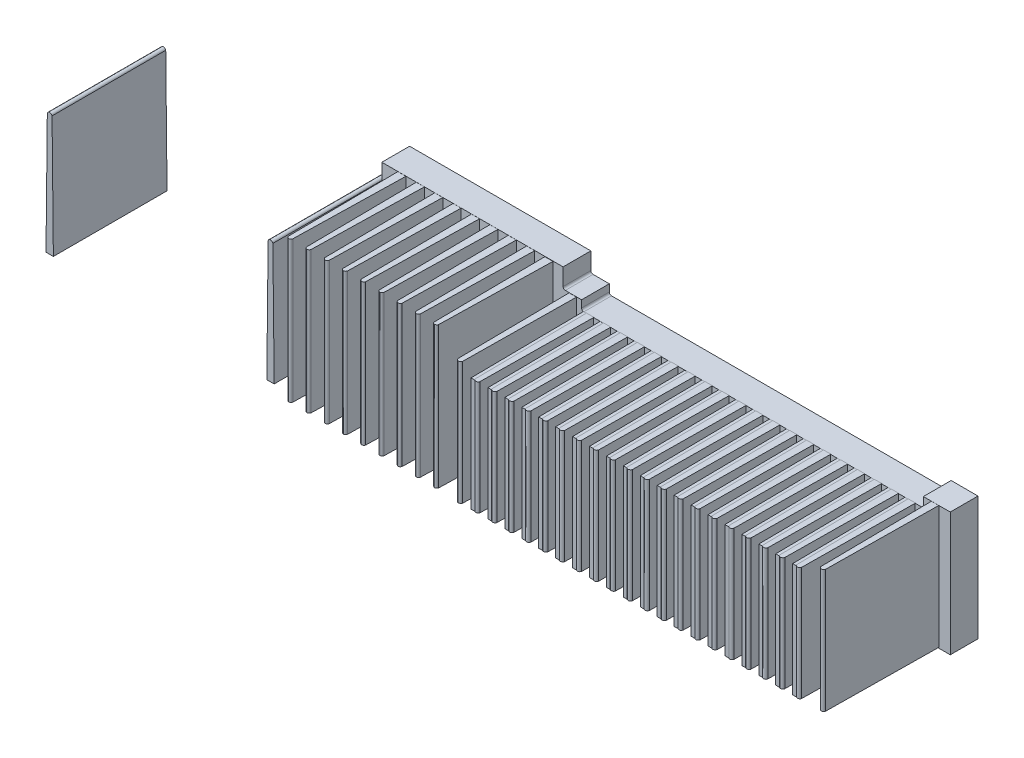
from build123d import *

# Parameters (mm, degrees)
BOSS_EXTRUDE1_DEPTH    = 9.5758
BOSS_EXTRUDE2_DEPTH    = 39.2303
BOSS_EXTRUDE2_2_DEPTH  = 39.2303
BOSS_EXTRUDE2_3_DEPTH  = 39.2303
BOSS_EXTRUDE2_4_DEPTH  = 39.2303
BOSS_EXTRUDE2_5_DEPTH  = 39.2303
BOSS_EXTRUDE2_6_DEPTH  = 39.2303
BOSS_EXTRUDE2_7_DEPTH  = 39.2303
BOSS_EXTRUDE2_8_DEPTH  = 39.2303
BOSS_EXTRUDE2_9_DEPTH  = 39.2303
BOSS_EXTRUDE2_10_DEPTH = 39.2303
BOSS_EXTRUDE2_11_DEPTH = 39.2303
BOSS_EXTRUDE2_12_DEPTH = 39.2303
BOSS_EXTRUDE2_13_DEPTH = 39.2303
BOSS_EXTRUDE2_14_DEPTH = 39.2303
BOSS_EXTRUDE2_15_DEPTH = 39.2303
BOSS_EXTRUDE2_16_DEPTH = 39.2303
BOSS_EXTRUDE2_17_DEPTH = 39.2303
BOSS_EXTRUDE2_18_DEPTH = 39.2303
BOSS_EXTRUDE2_19_DEPTH = 39.2303
BOSS_EXTRUDE2_20_DEPTH = 39.2303
BODY_MOVE_COPY1_ANGLE  = 90
BOSS_EXTRUDE3_DEPTH    = 48.8315
BOSS_EXTRUDE3_2_DEPTH  = 48.8315
BOSS_EXTRUDE3_3_DEPTH  = 48.8315
BOSS_EXTRUDE3_4_DEPTH  = 48.8315
BOSS_EXTRUDE3_5_DEPTH  = 48.8315
BOSS_EXTRUDE3_6_DEPTH  = 48.8315
BOSS_EXTRUDE3_7_DEPTH  = 48.8315
BOSS_EXTRUDE3_8_DEPTH  = 48.8315
BOSS_EXTRUDE3_9_DEPTH  = 48.8315
BODY_MOVE_COPY4_ANGLE  = 90.001090824
SKETCH40_W             = 9.271
SKETCH40_H             = 6.466041836
CUT_EXTRUDE1_DEPTH     = 213.052248313
FILLET2_R              = 0.762
FILLET3_R              = 0.762
FILLET4_R              = 0.762
BOSS_EXTRUDE4_DEPTH    = 39.2303
BOSS_EXTRUDE4_2_DEPTH  = 39.2303
BOSS_EXTRUDE4_3_DEPTH  = 39.2303
BOSS_EXTRUDE4_4_DEPTH  = 39.2303
BOSS_EXTRUDE4_5_DEPTH  = 39.2303
BOSS_EXTRUDE4_6_DEPTH  = 39.2303
BOSS_EXTRUDE4_7_DEPTH  = 39.2303
BOSS_EXTRUDE4_8_DEPTH  = 39.2303
BOSS_EXTRUDE4_9_DEPTH  = 39.2303
BOSS_EXTRUDE4_10_DEPTH = 39.2303
BOSS_EXTRUDE4_11_DEPTH = 39.2303
BOSS_EXTRUDE4_12_DEPTH = 39.2303
BOSS_EXTRUDE4_13_DEPTH = 39.2303
BOSS_EXTRUDE4_14_DEPTH = 39.2303
BOSS_EXTRUDE4_15_DEPTH = 39.2303
BOSS_EXTRUDE4_16_DEPTH = 39.2303
BOSS_EXTRUDE4_17_DEPTH = 39.2303
BOSS_EXTRUDE4_18_DEPTH = 39.2303
BOSS_EXTRUDE4_19_DEPTH = 39.2303
BOSS_EXTRUDE4_20_DEPTH = 39.2303
BODY_MOVE_COPY6_ANGLE  = 90
BOSS_EXTRUDE5_DEPTH    = 39.2303
BOSS_EXTRUDE5_2_DEPTH  = 39.2303
BOSS_EXTRUDE6_DEPTH    = 42.418
BOSS_EXTRUDE6_2_DEPTH  = 42.418
BODY_MOVE_COPY8_ANGLE  = 90


with BuildPart() as part:
    # Sketch1 → Boss-Extrude1 (new body)
    with BuildSketch(Plane.XY):
        Polygon((193.2305, 49.145371092), (193.2305, 39.267041383), (75.26958247, 39.267041383), (75.26958247, 42.495421295), (68.8975, 42.495421295), (68.8975, 49.145371092), (6.35, 49.145371092), (6.35, 42.495421295), (6.35, 0), (202.5015, 0), (202.5015, 49.145371092), align=None)
    extrude(amount=BOSS_EXTRUDE1_DEPTH)

    # Sketch40 → Cut-Extrude1 (cut, through all)
    with BuildSketch(Plane.XY.offset(9.5758)):
        with Locations((197.866, 45.912350174)):
            Rectangle(SKETCH40_W, SKETCH40_H)
    extrude(amount=-CUT_EXTRUDE1_DEPTH, mode=Mode.SUBTRACT)

    # Fillet2
    fillet2_edges = [part.edges().sort_by_distance(p)[0] for p in [
        (68.8975, 42.495421295, 4.7879),
    ]]
    fillet(fillet2_edges, radius=FILLET2_R)

    # Fillet3
    fillet3_edges = [part.edges().sort_by_distance(p)[0] for p in [
        (75.26958247, 39.267041383, 4.7879),
    ]]
    fillet(fillet3_edges, radius=FILLET3_R)

    # Fillet4
    fillet4_edges = [part.edges().sort_by_distance(p)[0] for p in [
        (193.2305, 39.267041383, 4.7879),
    ]]
    fillet(fillet4_edges, radius=FILLET4_R)


with BuildPart() as body_2:
    # Sketch 2 → Boss-Extrude2 (new body)
    with BuildSketch(Plane(origin=(57.15, 0, 0), x_dir=(1, 0, 0), z_dir=(0, 0, 1))):
        Polygon((132.141789869, 39.038500184), (134.001430641, 39.038500184), (134.439580641, -0.191799816), (132.903789869, -0.191799816), (131.703639869, -0.191799816), align=None)
    extrude(amount=BOSS_EXTRUDE2_DEPTH)


with BuildPart() as body_3:
    # Sketch 2 → Boss-Extrude2 2 (new body)
    with BuildSketch(Plane(origin=(57.15, 0, 0), x_dir=(1, 0, 0), z_dir=(0, 0, 1))):
        Polygon((127.061789869, -0.191799816), (125.861639869, -0.191799816), (126.299789869, 39.038500184), (128.159430641, 39.038500184), (128.597580641, -0.191799816), align=None)
    extrude(amount=BOSS_EXTRUDE2_2_DEPTH)


with BuildPart() as body_4:
    # Sketch 2 → Boss-Extrude2 3 (new body)
    with BuildSketch(Plane(origin=(57.15, 0, 0), x_dir=(1, 0, 0), z_dir=(0, 0, 1))):
        Polygon((121.219789869, -0.191799816), (120.019639869, -0.191799816), (120.457789869, 39.038500184), (122.317430641, 39.038500184), (122.755580641, -0.191799816), align=None)
    extrude(amount=BOSS_EXTRUDE2_3_DEPTH)


with BuildPart() as body_5:
    # Sketch 2 → Boss-Extrude2 4 (new body)
    with BuildSketch(Plane(origin=(57.15, 0, 0), x_dir=(1, 0, 0), z_dir=(0, 0, 1))):
        Polygon((115.377789869, -0.191799816), (114.177639869, -0.191799816), (114.615789869, 39.038500184), (116.475430641, 39.038500184), (116.913580641, -0.191799816), align=None)
    extrude(amount=BOSS_EXTRUDE2_4_DEPTH)


with BuildPart() as body_6:
    # Sketch 2 → Boss-Extrude2 5 (new body)
    with BuildSketch(Plane(origin=(57.15, 0, 0), x_dir=(1, 0, 0), z_dir=(0, 0, 1))):
        Polygon((109.535789869, -0.191799816), (108.335639869, -0.191799816), (108.773789869, 39.038500184), (110.633430641, 39.038500184), (111.071580641, -0.191799816), align=None)
    extrude(amount=BOSS_EXTRUDE2_5_DEPTH)


with BuildPart() as body_7:
    # Sketch 2 → Boss-Extrude2 6 (new body)
    with BuildSketch(Plane(origin=(57.15, 0, 0), x_dir=(1, 0, 0), z_dir=(0, 0, 1))):
        Polygon((103.693789869, -0.191799816), (102.493639869, -0.191799816), (102.931789869, 39.038500184), (104.791430641, 39.038500184), (105.229580641, -0.191799816), align=None)
    extrude(amount=BOSS_EXTRUDE2_6_DEPTH)


with BuildPart() as body_8:
    # Sketch 2 → Boss-Extrude2 7 (new body)
    with BuildSketch(Plane(origin=(57.15, 0, 0), x_dir=(1, 0, 0), z_dir=(0, 0, 1))):
        Polygon((97.851789869, -0.191799816), (96.651639869, -0.191799816), (97.089789869, 39.038500184), (98.949430641, 39.038500184), (99.387580641, -0.191799816), align=None)
    extrude(amount=BOSS_EXTRUDE2_7_DEPTH)


with BuildPart() as body_9:
    # Sketch 2 → Boss-Extrude2 8 (new body)
    with BuildSketch(Plane(origin=(57.15, 0, 0), x_dir=(1, 0, 0), z_dir=(0, 0, 1))):
        Polygon((92.009789869, -0.191799816), (90.809639869, -0.191799816), (91.247789869, 39.038500184), (93.107430641, 39.038500184), (93.545580641, -0.191799816), align=None)
    extrude(amount=BOSS_EXTRUDE2_8_DEPTH)


with BuildPart() as body_10:
    # Sketch 2 → Boss-Extrude2 9 (new body)
    with BuildSketch(Plane(origin=(57.15, 0, 0), x_dir=(1, 0, 0), z_dir=(0, 0, 1))):
        Polygon((86.167789869, -0.191799816), (84.967639869, -0.191799816), (85.405789869, 39.038500184), (87.265430641, 39.038500184), (87.703580641, -0.191799816), align=None)
    extrude(amount=BOSS_EXTRUDE2_9_DEPTH)


with BuildPart() as body_11:
    # Sketch 2 → Boss-Extrude2 10 (new body)
    with BuildSketch(Plane(origin=(57.15, 0, 0), x_dir=(1, 0, 0), z_dir=(0, 0, 1))):
        Polygon((80.325789869, -0.191799816), (79.125639869, -0.191799816), (79.563789869, 39.038500184), (81.423430641, 39.038500184), (81.861580641, -0.191799816), align=None)
    extrude(amount=BOSS_EXTRUDE2_10_DEPTH)


with BuildPart() as body_12:
    # Sketch 2 → Boss-Extrude2 11 (new body)
    with BuildSketch(Plane(origin=(57.15, 0, 0), x_dir=(1, 0, 0), z_dir=(0, 0, 1))):
        Polygon((74.483789869, -0.191799816), (73.283639869, -0.191799816), (73.721789869, 39.038500184), (75.581430641, 39.038500184), (76.019580641, -0.191799816), align=None)
    extrude(amount=BOSS_EXTRUDE2_11_DEPTH)


with BuildPart() as body_13:
    # Sketch 2 → Boss-Extrude2 12 (new body)
    with BuildSketch(Plane(origin=(57.15, 0, 0), x_dir=(1, 0, 0), z_dir=(0, 0, 1))):
        Polygon((68.641789869, -0.191799816), (67.441639869, -0.191799816), (67.879789869, 39.038500184), (69.739430641, 39.038500184), (70.177580641, -0.191799816), align=None)
    extrude(amount=BOSS_EXTRUDE2_12_DEPTH)


with BuildPart() as body_14:
    # Sketch 2 → Boss-Extrude2 13 (new body)
    with BuildSketch(Plane(origin=(57.15, 0, 0), x_dir=(1, 0, 0), z_dir=(0, 0, 1))):
        Polygon((62.799789869, -0.191799816), (61.599639869, -0.191799816), (62.037789869, 39.038500184), (63.897430641, 39.038500184), (64.335580641, -0.191799816), align=None)
    extrude(amount=BOSS_EXTRUDE2_13_DEPTH)


with BuildPart() as body_15:
    # Sketch 2 → Boss-Extrude2 14 (new body)
    with BuildSketch(Plane(origin=(57.15, 0, 0), x_dir=(1, 0, 0), z_dir=(0, 0, 1))):
        Polygon((56.957789869, -0.191799816), (55.757639869, -0.191799816), (56.195789869, 39.038500184), (58.055430641, 39.038500184), (58.493580641, -0.191799816), align=None)
    extrude(amount=BOSS_EXTRUDE2_14_DEPTH)


with BuildPart() as body_16:
    # Sketch 2 → Boss-Extrude2 15 (new body)
    with BuildSketch(Plane(origin=(57.15, 0, 0), x_dir=(1, 0, 0), z_dir=(0, 0, 1))):
        Polygon((51.115789869, -0.191799816), (49.915639869, -0.191799816), (50.353789869, 39.038500184), (52.213430641, 39.038500184), (52.651580641, -0.191799816), align=None)
    extrude(amount=BOSS_EXTRUDE2_15_DEPTH)


with BuildPart() as body_17:
    # Sketch 2 → Boss-Extrude2 16 (new body)
    with BuildSketch(Plane(origin=(57.15, 0, 0), x_dir=(1, 0, 0), z_dir=(0, 0, 1))):
        Polygon((45.273789869, -0.191799816), (44.073639869, -0.191799816), (44.511789869, 39.038500184), (46.371430641, 39.038500184), (46.809580641, -0.191799816), align=None)
    extrude(amount=BOSS_EXTRUDE2_16_DEPTH)


with BuildPart() as body_18:
    # Sketch 2 → Boss-Extrude2 17 (new body)
    with BuildSketch(Plane(origin=(57.15, 0, 0), x_dir=(1, 0, 0), z_dir=(0, 0, 1))):
        Polygon((39.431789869, -0.191799816), (38.231639869, -0.191799816), (38.669789869, 39.038500184), (40.529430641, 39.038500184), (40.967580641, -0.191799816), align=None)
    extrude(amount=BOSS_EXTRUDE2_17_DEPTH)


with BuildPart() as body_19:
    # Sketch 2 → Boss-Extrude2 18 (new body)
    with BuildSketch(Plane(origin=(57.15, 0, 0), x_dir=(1, 0, 0), z_dir=(0, 0, 1))):
        Polygon((33.589789869, -0.191799816), (32.389639869, -0.191799816), (32.827789869, 39.038500184), (34.687430641, 39.038500184), (35.125580641, -0.191799816), align=None)
    extrude(amount=BOSS_EXTRUDE2_18_DEPTH)


with BuildPart() as body_20:
    # Sketch 2 → Boss-Extrude2 19 (new body)
    with BuildSketch(Plane(origin=(57.15, 0, 0), x_dir=(1, 0, 0), z_dir=(0, 0, 1))):
        Polygon((27.747789869, -0.191799816), (26.547639869, -0.191799816), (26.985789869, 39.038500184), (28.845430641, 39.038500184), (29.283580641, -0.191799816), align=None)
    extrude(amount=BOSS_EXTRUDE2_19_DEPTH)


with BuildPart() as body_21:
    # Sketch 2 → Boss-Extrude2 20 (new body)
    with BuildSketch(Plane(origin=(57.15, 0, 0), x_dir=(1, 0, 0), z_dir=(0, 0, 1))):
        Polygon((21.905789869, -0.191799816), (20.705639869, -0.191799816), (21.143789869, 39.038500184), (23.003430641, 39.038500184), (23.441580641, -0.191799816), align=None)
    extrude(amount=BOSS_EXTRUDE2_20_DEPTH)


with BuildPart() as body_2_1:
    # Body-Move/Copy1: moved
    add(body_2.part.rotate(Axis((0, 19.423350184, 19.61515), (1, 0, 0)), BODY_MOVE_COPY1_ANGLE))


with BuildPart() as body_3_1:
    # Body-Move/Copy1: moved
    add(body_3.part.rotate(Axis((0, 19.423350184, 19.61515), (1, 0, 0)), BODY_MOVE_COPY1_ANGLE))


with BuildPart() as body_4_1:
    # Body-Move/Copy1: moved
    add(body_4.part.rotate(Axis((0, 19.423350184, 19.61515), (1, 0, 0)), BODY_MOVE_COPY1_ANGLE))


with BuildPart() as body_5_1:
    # Body-Move/Copy1: moved
    add(body_5.part.rotate(Axis((0, 19.423350184, 19.61515), (1, 0, 0)), BODY_MOVE_COPY1_ANGLE))


with BuildPart() as body_6_1:
    # Body-Move/Copy1: moved
    add(body_6.part.rotate(Axis((0, 19.423350184, 19.61515), (1, 0, 0)), BODY_MOVE_COPY1_ANGLE))


with BuildPart() as body_7_1:
    # Body-Move/Copy1: moved
    add(body_7.part.rotate(Axis((0, 19.423350184, 19.61515), (1, 0, 0)), BODY_MOVE_COPY1_ANGLE))


with BuildPart() as body_8_1:
    # Body-Move/Copy1: moved
    add(body_8.part.rotate(Axis((0, 19.423350184, 19.61515), (1, 0, 0)), BODY_MOVE_COPY1_ANGLE))


with BuildPart() as body_9_1:
    # Body-Move/Copy1: moved
    add(body_9.part.rotate(Axis((0, 19.423350184, 19.61515), (1, 0, 0)), BODY_MOVE_COPY1_ANGLE))


with BuildPart() as body_10_1:
    # Body-Move/Copy1: moved
    add(body_10.part.rotate(Axis((0, 19.423350184, 19.61515), (1, 0, 0)), BODY_MOVE_COPY1_ANGLE))


with BuildPart() as body_11_1:
    # Body-Move/Copy1: moved
    add(body_11.part.rotate(Axis((0, 19.423350184, 19.61515), (1, 0, 0)), BODY_MOVE_COPY1_ANGLE))


with BuildPart() as body_12_1:
    # Body-Move/Copy1: moved
    add(body_12.part.rotate(Axis((0, 19.423350184, 19.61515), (1, 0, 0)), BODY_MOVE_COPY1_ANGLE))


with BuildPart() as body_13_1:
    # Body-Move/Copy1: moved
    add(body_13.part.rotate(Axis((0, 19.423350184, 19.61515), (1, 0, 0)), BODY_MOVE_COPY1_ANGLE))


with BuildPart() as body_14_1:
    # Body-Move/Copy1: moved
    add(body_14.part.rotate(Axis((0, 19.423350184, 19.61515), (1, 0, 0)), BODY_MOVE_COPY1_ANGLE))


with BuildPart() as body_15_1:
    # Body-Move/Copy1: moved
    add(body_15.part.rotate(Axis((0, 19.423350184, 19.61515), (1, 0, 0)), BODY_MOVE_COPY1_ANGLE))


with BuildPart() as body_16_1:
    # Body-Move/Copy1: moved
    add(body_16.part.rotate(Axis((0, 19.423350184, 19.61515), (1, 0, 0)), BODY_MOVE_COPY1_ANGLE))


with BuildPart() as body_17_1:
    # Body-Move/Copy1: moved
    add(body_17.part.rotate(Axis((0, 19.423350184, 19.61515), (1, 0, 0)), BODY_MOVE_COPY1_ANGLE))


with BuildPart() as body_18_1:
    # Body-Move/Copy1: moved
    add(body_18.part.rotate(Axis((0, 19.423350184, 19.61515), (1, 0, 0)), BODY_MOVE_COPY1_ANGLE))


with BuildPart() as body_19_1:
    # Body-Move/Copy1: moved
    add(body_19.part.rotate(Axis((0, 19.423350184, 19.61515), (1, 0, 0)), BODY_MOVE_COPY1_ANGLE))


with BuildPart() as body_20_1:
    # Body-Move/Copy1: moved
    add(body_20.part.rotate(Axis((0, 19.423350184, 19.61515), (1, 0, 0)), BODY_MOVE_COPY1_ANGLE))


with BuildPart() as body_21_1:
    # Body-Move/Copy1: moved
    add(body_21.part.rotate(Axis((0, 19.423350184, 19.61515), (1, 0, 0)), BODY_MOVE_COPY1_ANGLE))


with BuildPart() as body_2_2:
    # Body-Move/Copy2: moved
    add(body_2_1.part.moved(Location((-1.987847684, 0.225692283, 9.531041808))))


with BuildPart() as body_3_2:
    # Body-Move/Copy2: moved
    add(body_3_1.part.moved(Location((-1.987847684, 0.225692283, 9.531041808))))


with BuildPart() as body_4_2:
    # Body-Move/Copy2: moved
    add(body_4_1.part.moved(Location((-1.987847684, 0.225692283, 9.531041808))))


with BuildPart() as body_5_2:
    # Body-Move/Copy2: moved
    add(body_5_1.part.moved(Location((-1.987847684, 0.225692283, 9.531041808))))


with BuildPart() as body_6_2:
    # Body-Move/Copy2: moved
    add(body_6_1.part.moved(Location((-1.987847684, 0.225692283, 9.531041808))))


with BuildPart() as body_7_2:
    # Body-Move/Copy2: moved
    add(body_7_1.part.moved(Location((-1.987847684, 0.225692283, 9.531041808))))


with BuildPart() as body_8_2:
    # Body-Move/Copy2: moved
    add(body_8_1.part.moved(Location((-1.987847684, 0.225692283, 9.531041808))))


with BuildPart() as body_9_2:
    # Body-Move/Copy2: moved
    add(body_9_1.part.moved(Location((-1.987847684, 0.225692283, 9.531041808))))


with BuildPart() as body_10_2:
    # Body-Move/Copy2: moved
    add(body_10_1.part.moved(Location((-1.987847684, 0.225692283, 9.531041808))))


with BuildPart() as body_11_2:
    # Body-Move/Copy2: moved
    add(body_11_1.part.moved(Location((-1.987847684, 0.225692283, 9.531041808))))


with BuildPart() as body_12_2:
    # Body-Move/Copy2: moved
    add(body_12_1.part.moved(Location((-1.987847684, 0.225692283, 9.531041808))))


with BuildPart() as body_13_2:
    # Body-Move/Copy2: moved
    add(body_13_1.part.moved(Location((-1.987847684, 0.225692283, 9.531041808))))


with BuildPart() as body_14_2:
    # Body-Move/Copy2: moved
    add(body_14_1.part.moved(Location((-1.987847684, 0.225692283, 9.531041808))))


with BuildPart() as body_15_2:
    # Body-Move/Copy2: moved
    add(body_15_1.part.moved(Location((-1.987847684, 0.225692283, 9.531041808))))


with BuildPart() as body_16_2:
    # Body-Move/Copy2: moved
    add(body_16_1.part.moved(Location((-1.987847684, 0.225692283, 9.531041808))))


with BuildPart() as body_17_2:
    # Body-Move/Copy2: moved
    add(body_17_1.part.moved(Location((-1.987847684, 0.225692283, 9.531041808))))


with BuildPart() as body_18_2:
    # Body-Move/Copy2: moved
    add(body_18_1.part.moved(Location((-1.987847684, 0.225692283, 9.531041808))))


with BuildPart() as body_19_2:
    # Body-Move/Copy2: moved
    add(body_19_1.part.moved(Location((-1.987847684, 0.225692283, 9.531041808))))


with BuildPart() as body_20_2:
    # Body-Move/Copy2: moved
    add(body_20_1.part.moved(Location((-1.987847684, 0.225692283, 9.531041808))))


with BuildPart() as body_21_2:
    # Body-Move/Copy2: moved
    add(body_21_1.part.moved(Location((-1.987847684, 0.225692283, 9.531041808))))


with BuildPart() as body_22:
    # Sketch3 → Boss-Extrude3 (new body)
    with BuildSketch(Plane(origin=(-73.869457939, 0, 0), x_dir=(1, 0, 0), z_dir=(0, 0, 1))):
        with BuildLine():
            Line((66.446485136, 9.324555755), (67.843485136, 9.324555755))
            Line((67.843485136, 9.324555755), (67.340900287, 47.916529457))
            ThreePointArc((67.340900287, 47.916529457), (67.069764983, 48.372313491), (66.570630656, 48.551529457))
            ThreePointArc((66.570630656, 48.551529457), (66.069944042, 48.372477378), (65.796341729, 47.916529457))
            Line((65.796341729, 47.916529457), (65.049485136, 9.324555755))
            Line((65.049485136, 9.324555755), (66.446485136, 9.324555755))
        make_face()
    extrude(amount=BOSS_EXTRUDE3_DEPTH)


with BuildPart() as body_23:
    # Sketch3 → Boss-Extrude3 2 (new body)
    with BuildSketch(Plane(origin=(-73.869457939, 0, 0), x_dir=(1, 0, 0), z_dir=(0, 0, 1))):
        with BuildLine():
            Line((59.446341729, 47.916529457), (58.699485136, 9.324555755))
            Line((58.699485136, 9.324555755), (60.096485136, 9.324555755))
            Line((60.096485136, 9.324555755), (61.493485136, 9.324555755))
            Line((61.493485136, 9.324555755), (60.990900287, 47.916529457))
            ThreePointArc((60.990900287, 47.916529457), (60.719764983, 48.372313491), (60.220630656, 48.551529457))
            ThreePointArc((60.220630656, 48.551529457), (59.719944042, 48.372477378), (59.446341729, 47.916529457))
        make_face()
    extrude(amount=BOSS_EXTRUDE3_2_DEPTH)


with BuildPart() as body_24:
    # Sketch3 → Boss-Extrude3 3 (new body)
    with BuildSketch(Plane(origin=(-73.869457939, 0, 0), x_dir=(1, 0, 0), z_dir=(0, 0, 1))):
        with BuildLine():
            Line((53.096341729, 47.916529457), (52.349485136, 9.324555755))
            Line((52.349485136, 9.324555755), (53.746485136, 9.324555755))
            Line((53.746485136, 9.324555755), (55.143485136, 9.324555755))
            Line((55.143485136, 9.324555755), (54.640900287, 47.916529457))
            ThreePointArc((54.640900287, 47.916529457), (54.369764983, 48.372313491), (53.870630656, 48.551529457))
            ThreePointArc((53.870630656, 48.551529457), (53.369944042, 48.372477378), (53.096341729, 47.916529457))
        make_face()
    extrude(amount=BOSS_EXTRUDE3_3_DEPTH)


with BuildPart() as body_25:
    # Sketch3 → Boss-Extrude3 4 (new body)
    with BuildSketch(Plane(origin=(-73.869457939, 0, 0), x_dir=(1, 0, 0), z_dir=(0, 0, 1))):
        with BuildLine():
            Line((46.746341729, 47.916529457), (45.999485136, 9.324555755))
            Line((45.999485136, 9.324555755), (47.396485136, 9.324555755))
            Line((47.396485136, 9.324555755), (48.793485136, 9.324555755))
            Line((48.793485136, 9.324555755), (48.290900287, 47.916529457))
            ThreePointArc((48.290900287, 47.916529457), (48.019764983, 48.372313491), (47.520630656, 48.551529457))
            ThreePointArc((47.520630656, 48.551529457), (47.019944042, 48.372477378), (46.746341729, 47.916529457))
        make_face()
    extrude(amount=BOSS_EXTRUDE3_4_DEPTH)


with BuildPart() as body_26:
    # Sketch3 → Boss-Extrude3 5 (new body)
    with BuildSketch(Plane(origin=(-73.869457939, 0, 0), x_dir=(1, 0, 0), z_dir=(0, 0, 1))):
        with BuildLine():
            Line((40.396341729, 47.916529457), (39.649485136, 9.324555755))
            Line((39.649485136, 9.324555755), (41.046485136, 9.324555755))
            Line((41.046485136, 9.324555755), (42.443485136, 9.324555755))
            Line((42.443485136, 9.324555755), (41.940900287, 47.916529457))
            ThreePointArc((41.940900287, 47.916529457), (41.669764983, 48.372313491), (41.170630656, 48.551529457))
            ThreePointArc((41.170630656, 48.551529457), (40.669944042, 48.372477378), (40.396341729, 47.916529457))
        make_face()
    extrude(amount=BOSS_EXTRUDE3_5_DEPTH)


with BuildPart() as body_27:
    # Sketch3 → Boss-Extrude3 6 (new body)
    with BuildSketch(Plane(origin=(-73.869457939, 0, 0), x_dir=(1, 0, 0), z_dir=(0, 0, 1))):
        with BuildLine():
            Line((34.046341729, 47.916529457), (33.299485136, 9.324555755))
            Line((33.299485136, 9.324555755), (34.696485136, 9.324555755))
            Line((34.696485136, 9.324555755), (36.093485136, 9.324555755))
            Line((36.093485136, 9.324555755), (35.590900287, 47.916529457))
            ThreePointArc((35.590900287, 47.916529457), (35.319764983, 48.372313491), (34.820630656, 48.551529457))
            ThreePointArc((34.820630656, 48.551529457), (34.319944042, 48.372477378), (34.046341729, 47.916529457))
        make_face()
    extrude(amount=BOSS_EXTRUDE3_6_DEPTH)


with BuildPart() as body_28:
    # Sketch3 → Boss-Extrude3 7 (new body)
    with BuildSketch(Plane(origin=(-73.869457939, 0, 0), x_dir=(1, 0, 0), z_dir=(0, 0, 1))):
        with BuildLine():
            Line((27.696341729, 47.916529457), (26.949485136, 9.324555755))
            Line((26.949485136, 9.324555755), (28.346485136, 9.324555755))
            Line((28.346485136, 9.324555755), (29.743485136, 9.324555755))
            Line((29.743485136, 9.324555755), (29.240900287, 47.916529457))
            ThreePointArc((29.240900287, 47.916529457), (28.969764983, 48.372313491), (28.470630656, 48.551529457))
            ThreePointArc((28.470630656, 48.551529457), (27.969944042, 48.372477378), (27.696341729, 47.916529457))
        make_face()
    extrude(amount=BOSS_EXTRUDE3_7_DEPTH)


with BuildPart() as body_29:
    # Sketch3 → Boss-Extrude3 8 (new body)
    with BuildSketch(Plane(origin=(-73.869457939, 0, 0), x_dir=(1, 0, 0), z_dir=(0, 0, 1))):
        with BuildLine():
            Line((21.346341729, 47.916529457), (20.599485136, 9.324555755))
            Line((20.599485136, 9.324555755), (21.996485136, 9.324555755))
            Line((21.996485136, 9.324555755), (23.393485136, 9.324555755))
            Line((23.393485136, 9.324555755), (22.890900287, 47.916529457))
            ThreePointArc((22.890900287, 47.916529457), (22.619764983, 48.372313491), (22.120630656, 48.551529457))
            ThreePointArc((22.120630656, 48.551529457), (21.619944042, 48.372477378), (21.346341729, 47.916529457))
        make_face()
    extrude(amount=BOSS_EXTRUDE3_8_DEPTH)


with BuildPart() as body_30:
    # Sketch3 → Boss-Extrude3 9 (new body)
    with BuildSketch(Plane(origin=(-73.869457939, 0, 0), x_dir=(1, 0, 0), z_dir=(0, 0, 1))):
        with BuildLine():
            Line((14.996341729, 47.916529457), (14.249485136, 9.324555755))
            Line((14.249485136, 9.324555755), (15.646485136, 9.324555755))
            Line((15.646485136, 9.324555755), (17.043485136, 9.324555755))
            Line((17.043485136, 9.324555755), (16.540900287, 47.916529457))
            ThreePointArc((16.540900287, 47.916529457), (16.269764983, 48.372313491), (15.770630656, 48.551529457))
            ThreePointArc((15.770630656, 48.551529457), (15.269944042, 48.372477378), (14.996341729, 47.916529457))
        make_face()
    extrude(amount=BOSS_EXTRUDE3_9_DEPTH)


with BuildPart() as body_30_1:
    # Body-Move/Copy3: moved
    add(body_30.part.moved(Location((70.956358251, 0.052910213, 0.548119442))))


with BuildPart() as body_29_1:
    # Body-Move/Copy3: moved
    add(body_29.part.moved(Location((70.956358251, 0.052910213, 0.548119442))))


with BuildPart() as body_28_1:
    # Body-Move/Copy3: moved
    add(body_28.part.moved(Location((70.956358251, 0.052910213, 0.548119442))))


with BuildPart() as body_27_1:
    # Body-Move/Copy3: moved
    add(body_27.part.moved(Location((70.956358251, 0.052910213, 0.548119442))))


with BuildPart() as body_26_1:
    # Body-Move/Copy3: moved
    add(body_26.part.moved(Location((70.956358251, 0.052910213, 0.548119442))))


with BuildPart() as body_25_1:
    # Body-Move/Copy3: moved
    add(body_25.part.moved(Location((70.956358251, 0.052910213, 0.548119442))))


with BuildPart() as body_24_1:
    # Body-Move/Copy3: moved
    add(body_24.part.moved(Location((70.956358251, 0.052910213, 0.548119442))))


with BuildPart() as body_23_1:
    # Body-Move/Copy3: moved
    add(body_23.part.moved(Location((70.956358251, 0.052910213, 0.548119442))))


with BuildPart() as body_22_1:
    # Body-Move/Copy3: moved
    add(body_22.part.moved(Location((70.956358251, 0.052910213, 0.548119442))))


with BuildPart() as body_22_2:
    # Body-Move/Copy4: moved
    add(body_22_1.part.moved(Location((0, 0, 0))).rotate(Axis((-0.023693675, 24.416041434, 29.84619722), (0.9999809617133139, -0.004363267749977908, 0.004363267749975212)), BODY_MOVE_COPY4_ANGLE))


with BuildPart() as body_23_2:
    # Body-Move/Copy4: moved
    add(body_23_1.part.moved(Location((0, 0, 0))).rotate(Axis((-0.023693675, 24.416041434, 29.84619722), (0.9999809617133139, -0.004363267749977908, 0.004363267749975212)), BODY_MOVE_COPY4_ANGLE))


with BuildPart() as body_24_2:
    # Body-Move/Copy4: moved
    add(body_24_1.part.moved(Location((0, 0, 0))).rotate(Axis((-0.023693675, 24.416041434, 29.84619722), (0.9999809617133139, -0.004363267749977908, 0.004363267749975212)), BODY_MOVE_COPY4_ANGLE))


with BuildPart() as body_26_2:
    # Body-Move/Copy4: moved
    add(body_26_1.part.moved(Location((0, 0, 0))).rotate(Axis((-0.023693675, 24.416041434, 29.84619722), (0.9999809617133139, -0.004363267749977908, 0.004363267749975212)), BODY_MOVE_COPY4_ANGLE))


with BuildPart() as body_27_2:
    # Body-Move/Copy4: moved
    add(body_27_1.part.moved(Location((0, 0, 0))).rotate(Axis((-0.023693675, 24.416041434, 29.84619722), (0.9999809617133139, -0.004363267749977908, 0.004363267749975212)), BODY_MOVE_COPY4_ANGLE))


with BuildPart() as body_28_2:
    # Body-Move/Copy4: moved
    add(body_28_1.part.moved(Location((0, 0, 0))).rotate(Axis((-0.023693675, 24.416041434, 29.84619722), (0.9999809617133139, -0.004363267749977908, 0.004363267749975212)), BODY_MOVE_COPY4_ANGLE))


with BuildPart() as body_29_2:
    # Body-Move/Copy4: moved
    add(body_29_1.part.moved(Location((0, 0, 0))).rotate(Axis((-0.023693675, 24.416041434, 29.84619722), (0.9999809617133139, -0.004363267749977908, 0.004363267749975212)), BODY_MOVE_COPY4_ANGLE))


with BuildPart() as body_30_2:
    # Body-Move/Copy4: moved
    add(body_30_1.part.moved(Location((0, 0, 0))).rotate(Axis((-0.023693675, 24.416041434, 29.84619722), (0.9999809617133139, -0.004363267749977908, 0.004363267749975212)), BODY_MOVE_COPY4_ANGLE))


with BuildPart() as body_25_2:
    # Body-Move/Copy4: moved
    add(body_25_1.part.moved(Location((0, 0, 0))).rotate(Axis((-0.023693675, 24.416041434, 29.84619722), (0.9999809617133139, -0.004363267749977908, 0.004363267749975212)), BODY_MOVE_COPY4_ANGLE))


with BuildPart() as body_30_3:
    # Body-Move/Copy5: moved
    add(body_30_2.part.moved(Location((0.414149999, -4.601347327, -5.719460748))))


with BuildPart() as body_29_3:
    # Body-Move/Copy5: moved
    add(body_29_2.part.moved(Location((0.414149999, -4.601347327, -5.719460748))))


with BuildPart() as body_28_3:
    # Body-Move/Copy5: moved
    add(body_28_2.part.moved(Location((0.414149999, -4.601347327, -5.719460748))))


with BuildPart() as body_27_3:
    # Body-Move/Copy5: moved
    add(body_27_2.part.moved(Location((0.414149999, -4.601347327, -5.719460748))))


with BuildPart() as body_25_3:
    # Body-Move/Copy5: moved
    add(body_25_2.part.moved(Location((0.414149999, -4.601347327, -5.719460748))))


with BuildPart() as body_24_3:
    # Body-Move/Copy5: moved
    add(body_24_2.part.moved(Location((0.414149999, -4.601347327, -5.719460748))))


with BuildPart() as body_23_3:
    # Body-Move/Copy5: moved
    add(body_23_2.part.moved(Location((0.414149999, -4.601347327, -5.719460748))))


with BuildPart() as body_22_3:
    # Body-Move/Copy5: moved
    add(body_22_2.part.moved(Location((0.414149999, -4.601347327, -5.719460748))))


with BuildPart() as body_26_3:
    # Body-Move/Copy5: moved
    add(body_26_2.part.moved(Location((0.414149999, -4.601347327, -5.719460748))))


with BuildPart() as body_31:
    # Sketch4 → Boss-Extrude4 (new body)
    with BuildSketch(Plane.XY):
        with BuildLine():
            Line((-24.214946698, 0.045332592), (-24.664705618, 38.887012592))
            ThreePointArc((-24.664705618, 38.887012592), (-25.484946698, 39.529632592), (-26.305187779, 38.887012592))
            Line((-26.305187779, 38.887012592), (-26.754946698, 0.045332592))
            Line((-26.754946698, 0.045332592), (-24.214946698, 0.045332592))
        make_face()
    extrude(amount=BOSS_EXTRUDE4_DEPTH)


with BuildPart() as body_32:
    # Sketch4 → Boss-Extrude4 2 (new body)
    with BuildSketch(Plane.XY):
        with BuildLine():
            Line((-135.212946698, 0.045332592), (-135.662705618, 38.887012592))
            ThreePointArc((-135.662705618, 38.887012592), (-136.482946698, 39.529632592), (-137.303187779, 38.887012592))
            Line((-137.303187779, 38.887012592), (-137.752946698, 0.045332592))
            Line((-137.752946698, 0.045332592), (-135.212946698, 0.045332592))
        make_face()
    extrude(amount=BOSS_EXTRUDE4_2_DEPTH)


with BuildPart() as body_33:
    # Sketch4 → Boss-Extrude4 3 (new body)
    with BuildSketch(Plane.XY):
        with BuildLine():
            Line((-129.370946698, 0.045332592), (-129.820705618, 38.887012592))
            ThreePointArc((-129.820705618, 38.887012592), (-130.640946698, 39.529632592), (-131.461187779, 38.887012592))
            Line((-131.461187779, 38.887012592), (-131.910946698, 0.045332592))
            Line((-131.910946698, 0.045332592), (-129.370946698, 0.045332592))
        make_face()
    extrude(amount=BOSS_EXTRUDE4_3_DEPTH)


with BuildPart() as body_34:
    # Sketch4 → Boss-Extrude4 4 (new body)
    with BuildSketch(Plane.XY):
        with BuildLine():
            Line((-123.528946698, 0.045332592), (-123.978705618, 38.887012592))
            ThreePointArc((-123.978705618, 38.887012592), (-124.798946698, 39.529632592), (-125.619187779, 38.887012592))
            Line((-125.619187779, 38.887012592), (-126.068946698, 0.045332592))
            Line((-126.068946698, 0.045332592), (-123.528946698, 0.045332592))
        make_face()
    extrude(amount=BOSS_EXTRUDE4_4_DEPTH)


with BuildPart() as body_35:
    # Sketch4 → Boss-Extrude4 5 (new body)
    with BuildSketch(Plane.XY):
        with BuildLine():
            Line((-117.686946698, 0.045332592), (-118.136705618, 38.887012592))
            ThreePointArc((-118.136705618, 38.887012592), (-118.956946698, 39.529632592), (-119.777187779, 38.887012592))
            Line((-119.777187779, 38.887012592), (-120.226946698, 0.045332592))
            Line((-120.226946698, 0.045332592), (-117.686946698, 0.045332592))
        make_face()
    extrude(amount=BOSS_EXTRUDE4_5_DEPTH)


with BuildPart() as body_36:
    # Sketch4 → Boss-Extrude4 6 (new body)
    with BuildSketch(Plane.XY):
        with BuildLine():
            Line((-111.844946698, 0.045332592), (-112.294705618, 38.887012592))
            ThreePointArc((-112.294705618, 38.887012592), (-113.114946698, 39.529632592), (-113.935187779, 38.887012592))
            Line((-113.935187779, 38.887012592), (-114.384946698, 0.045332592))
            Line((-114.384946698, 0.045332592), (-111.844946698, 0.045332592))
        make_face()
    extrude(amount=BOSS_EXTRUDE4_6_DEPTH)


with BuildPart() as body_37:
    # Sketch4 → Boss-Extrude4 7 (new body)
    with BuildSketch(Plane.XY):
        with BuildLine():
            Line((-106.002946698, 0.045332592), (-106.452705618, 38.887012592))
            ThreePointArc((-106.452705618, 38.887012592), (-107.272946698, 39.529632592), (-108.093187779, 38.887012592))
            Line((-108.093187779, 38.887012592), (-108.542946698, 0.045332592))
            Line((-108.542946698, 0.045332592), (-106.002946698, 0.045332592))
        make_face()
    extrude(amount=BOSS_EXTRUDE4_7_DEPTH)


with BuildPart() as body_38:
    # Sketch4 → Boss-Extrude4 8 (new body)
    with BuildSketch(Plane.XY):
        with BuildLine():
            Line((-100.160946698, 0.045332592), (-100.610705618, 38.887012592))
            ThreePointArc((-100.610705618, 38.887012592), (-101.430946698, 39.529632592), (-102.251187779, 38.887012592))
            Line((-102.251187779, 38.887012592), (-102.700946698, 0.045332592))
            Line((-102.700946698, 0.045332592), (-100.160946698, 0.045332592))
        make_face()
    extrude(amount=BOSS_EXTRUDE4_8_DEPTH)


with BuildPart() as body_39:
    # Sketch4 → Boss-Extrude4 9 (new body)
    with BuildSketch(Plane.XY):
        with BuildLine():
            Line((-94.318946698, 0.045332592), (-94.768705618, 38.887012592))
            ThreePointArc((-94.768705618, 38.887012592), (-95.588946698, 39.529632592), (-96.409187779, 38.887012592))
            Line((-96.409187779, 38.887012592), (-96.858946698, 0.045332592))
            Line((-96.858946698, 0.045332592), (-94.318946698, 0.045332592))
        make_face()
    extrude(amount=BOSS_EXTRUDE4_9_DEPTH)


with BuildPart() as body_40:
    # Sketch4 → Boss-Extrude4 10 (new body)
    with BuildSketch(Plane.XY):
        with BuildLine():
            Line((-88.476946698, 0.045332592), (-88.926705618, 38.887012592))
            ThreePointArc((-88.926705618, 38.887012592), (-89.746946698, 39.529632592), (-90.567187779, 38.887012592))
            Line((-90.567187779, 38.887012592), (-91.016946698, 0.045332592))
            Line((-91.016946698, 0.045332592), (-88.476946698, 0.045332592))
        make_face()
    extrude(amount=BOSS_EXTRUDE4_10_DEPTH)


with BuildPart() as body_41:
    # Sketch4 → Boss-Extrude4 11 (new body)
    with BuildSketch(Plane.XY):
        with BuildLine():
            Line((-82.634946698, 0.045332592), (-83.084705618, 38.887012592))
            ThreePointArc((-83.084705618, 38.887012592), (-83.904946698, 39.529632592), (-84.725187779, 38.887012592))
            Line((-84.725187779, 38.887012592), (-85.174946698, 0.045332592))
            Line((-85.174946698, 0.045332592), (-82.634946698, 0.045332592))
        make_face()
    extrude(amount=BOSS_EXTRUDE4_11_DEPTH)


with BuildPart() as body_42:
    # Sketch4 → Boss-Extrude4 12 (new body)
    with BuildSketch(Plane.XY):
        with BuildLine():
            Line((-76.792946698, 0.045332592), (-77.242705618, 38.887012592))
            ThreePointArc((-77.242705618, 38.887012592), (-78.062946698, 39.529632592), (-78.883187779, 38.887012592))
            Line((-78.883187779, 38.887012592), (-79.332946698, 0.045332592))
            Line((-79.332946698, 0.045332592), (-76.792946698, 0.045332592))
        make_face()
    extrude(amount=BOSS_EXTRUDE4_12_DEPTH)


with BuildPart() as body_43:
    # Sketch4 → Boss-Extrude4 13 (new body)
    with BuildSketch(Plane.XY):
        with BuildLine():
            Line((-70.950946698, 0.045332592), (-71.400705618, 38.887012592))
            ThreePointArc((-71.400705618, 38.887012592), (-72.220946698, 39.529632592), (-73.041187779, 38.887012592))
            Line((-73.041187779, 38.887012592), (-73.490946698, 0.045332592))
            Line((-73.490946698, 0.045332592), (-70.950946698, 0.045332592))
        make_face()
    extrude(amount=BOSS_EXTRUDE4_13_DEPTH)


with BuildPart() as body_44:
    # Sketch4 → Boss-Extrude4 14 (new body)
    with BuildSketch(Plane.XY):
        with BuildLine():
            Line((-65.108946698, 0.045332592), (-65.558705618, 38.887012592))
            ThreePointArc((-65.558705618, 38.887012592), (-66.378946698, 39.529632592), (-67.199187779, 38.887012592))
            Line((-67.199187779, 38.887012592), (-67.648946698, 0.045332592))
            Line((-67.648946698, 0.045332592), (-65.108946698, 0.045332592))
        make_face()
    extrude(amount=BOSS_EXTRUDE4_14_DEPTH)


with BuildPart() as body_45:
    # Sketch4 → Boss-Extrude4 15 (new body)
    with BuildSketch(Plane.XY):
        with BuildLine():
            Line((-59.266946698, 0.045332592), (-59.716705618, 38.887012592))
            ThreePointArc((-59.716705618, 38.887012592), (-60.536946698, 39.529632592), (-61.357187779, 38.887012592))
            Line((-61.357187779, 38.887012592), (-61.806946698, 0.045332592))
            Line((-61.806946698, 0.045332592), (-59.266946698, 0.045332592))
        make_face()
    extrude(amount=BOSS_EXTRUDE4_15_DEPTH)


with BuildPart() as body_46:
    # Sketch4 → Boss-Extrude4 16 (new body)
    with BuildSketch(Plane.XY):
        with BuildLine():
            Line((-53.424946698, 0.045332592), (-53.874705618, 38.887012592))
            ThreePointArc((-53.874705618, 38.887012592), (-54.694946698, 39.529632592), (-55.515187779, 38.887012592))
            Line((-55.515187779, 38.887012592), (-55.964946698, 0.045332592))
            Line((-55.964946698, 0.045332592), (-53.424946698, 0.045332592))
        make_face()
    extrude(amount=BOSS_EXTRUDE4_16_DEPTH)


with BuildPart() as body_47:
    # Sketch4 → Boss-Extrude4 17 (new body)
    with BuildSketch(Plane.XY):
        with BuildLine():
            Line((-47.582946698, 0.045332592), (-48.032705618, 38.887012592))
            ThreePointArc((-48.032705618, 38.887012592), (-48.852946698, 39.529632592), (-49.673187779, 38.887012592))
            Line((-49.673187779, 38.887012592), (-50.122946698, 0.045332592))
            Line((-50.122946698, 0.045332592), (-47.582946698, 0.045332592))
        make_face()
    extrude(amount=BOSS_EXTRUDE4_17_DEPTH)


with BuildPart() as body_48:
    # Sketch4 → Boss-Extrude4 18 (new body)
    with BuildSketch(Plane.XY):
        with BuildLine():
            Line((-41.740946698, 0.045332592), (-42.190705618, 38.887012592))
            ThreePointArc((-42.190705618, 38.887012592), (-43.010946698, 39.529632592), (-43.831187779, 38.887012592))
            Line((-43.831187779, 38.887012592), (-44.280946698, 0.045332592))
            Line((-44.280946698, 0.045332592), (-41.740946698, 0.045332592))
        make_face()
    extrude(amount=BOSS_EXTRUDE4_18_DEPTH)


with BuildPart() as body_49:
    # Sketch4 → Boss-Extrude4 19 (new body)
    with BuildSketch(Plane.XY):
        with BuildLine():
            Line((-35.898946698, 0.045332592), (-36.348705618, 38.887012592))
            ThreePointArc((-36.348705618, 38.887012592), (-37.168946698, 39.529632592), (-37.989187779, 38.887012592))
            Line((-37.989187779, 38.887012592), (-38.438946698, 0.045332592))
            Line((-38.438946698, 0.045332592), (-35.898946698, 0.045332592))
        make_face()
    extrude(amount=BOSS_EXTRUDE4_19_DEPTH)


with BuildPart() as body_50:
    # Sketch4 → Boss-Extrude4 20 (new body)
    with BuildSketch(Plane.XY):
        with BuildLine():
            Line((-30.056946698, 0.045332592), (-30.506705618, 38.887012592))
            ThreePointArc((-30.506705618, 38.887012592), (-31.326946698, 39.529632592), (-32.147187779, 38.887012592))
            Line((-32.147187779, 38.887012592), (-32.596946698, 0.045332592))
            Line((-32.596946698, 0.045332592), (-30.056946698, 0.045332592))
        make_face()
    extrude(amount=BOSS_EXTRUDE4_20_DEPTH)


with BuildPart() as body_32_1:
    # Body-Move/Copy6: moved
    add(body_32.part.rotate(Axis((0, 19.771417092, 19.61515), (1, 0, 0)), BODY_MOVE_COPY6_ANGLE))


with BuildPart() as body_35_1:
    # Body-Move/Copy6: moved
    add(body_35.part.rotate(Axis((0, 19.771417092, 19.61515), (1, 0, 0)), BODY_MOVE_COPY6_ANGLE))


with BuildPart() as body_33_1:
    # Body-Move/Copy6: moved
    add(body_33.part.rotate(Axis((0, 19.771417092, 19.61515), (1, 0, 0)), BODY_MOVE_COPY6_ANGLE))


with BuildPart() as body_38_1:
    # Body-Move/Copy6: moved
    add(body_38.part.rotate(Axis((0, 19.771417092, 19.61515), (1, 0, 0)), BODY_MOVE_COPY6_ANGLE))


with BuildPart() as body_36_1:
    # Body-Move/Copy6: moved
    add(body_36.part.rotate(Axis((0, 19.771417092, 19.61515), (1, 0, 0)), BODY_MOVE_COPY6_ANGLE))


with BuildPart() as body_39_1:
    # Body-Move/Copy6: moved
    add(body_39.part.rotate(Axis((0, 19.771417092, 19.61515), (1, 0, 0)), BODY_MOVE_COPY6_ANGLE))


with BuildPart() as body_40_1:
    # Body-Move/Copy6: moved
    add(body_40.part.rotate(Axis((0, 19.771417092, 19.61515), (1, 0, 0)), BODY_MOVE_COPY6_ANGLE))


with BuildPart() as body_41_1:
    # Body-Move/Copy6: moved
    add(body_41.part.rotate(Axis((0, 19.771417092, 19.61515), (1, 0, 0)), BODY_MOVE_COPY6_ANGLE))


with BuildPart() as body_42_1:
    # Body-Move/Copy6: moved
    add(body_42.part.rotate(Axis((0, 19.771417092, 19.61515), (1, 0, 0)), BODY_MOVE_COPY6_ANGLE))


with BuildPart() as body_43_1:
    # Body-Move/Copy6: moved
    add(body_43.part.rotate(Axis((0, 19.771417092, 19.61515), (1, 0, 0)), BODY_MOVE_COPY6_ANGLE))


with BuildPart() as body_44_1:
    # Body-Move/Copy6: moved
    add(body_44.part.rotate(Axis((0, 19.771417092, 19.61515), (1, 0, 0)), BODY_MOVE_COPY6_ANGLE))


with BuildPart() as body_45_1:
    # Body-Move/Copy6: moved
    add(body_45.part.rotate(Axis((0, 19.771417092, 19.61515), (1, 0, 0)), BODY_MOVE_COPY6_ANGLE))


with BuildPart() as body_46_1:
    # Body-Move/Copy6: moved
    add(body_46.part.rotate(Axis((0, 19.771417092, 19.61515), (1, 0, 0)), BODY_MOVE_COPY6_ANGLE))


with BuildPart() as body_47_1:
    # Body-Move/Copy6: moved
    add(body_47.part.rotate(Axis((0, 19.771417092, 19.61515), (1, 0, 0)), BODY_MOVE_COPY6_ANGLE))


with BuildPart() as body_48_1:
    # Body-Move/Copy6: moved
    add(body_48.part.rotate(Axis((0, 19.771417092, 19.61515), (1, 0, 0)), BODY_MOVE_COPY6_ANGLE))


with BuildPart() as body_49_1:
    # Body-Move/Copy6: moved
    add(body_49.part.rotate(Axis((0, 19.771417092, 19.61515), (1, 0, 0)), BODY_MOVE_COPY6_ANGLE))


with BuildPart() as body_50_1:
    # Body-Move/Copy6: moved
    add(body_50.part.rotate(Axis((0, 19.771417092, 19.61515), (1, 0, 0)), BODY_MOVE_COPY6_ANGLE))


with BuildPart() as body_37_1:
    # Body-Move/Copy6: moved
    add(body_37.part.rotate(Axis((0, 19.771417092, 19.61515), (1, 0, 0)), BODY_MOVE_COPY6_ANGLE))


with BuildPart() as body_34_1:
    # Body-Move/Copy6: moved
    add(body_34.part.rotate(Axis((0, 19.771417092, 19.61515), (1, 0, 0)), BODY_MOVE_COPY6_ANGLE))


with BuildPart() as body_31_1:
    # Body-Move/Copy6: moved
    add(body_31.part.rotate(Axis((0, 19.771417092, 19.61515), (1, 0, 0)), BODY_MOVE_COPY6_ANGLE))


with BuildPart() as body_32_2:
    # Body-Move/Copy7: moved
    add(body_32_1.part.moved(Location((214.63, -0.115099157, 9.574776634))))


with BuildPart() as body_33_2:
    # Body-Move/Copy7: moved
    add(body_33_1.part.moved(Location((214.63, -0.115099157, 9.574776634))))


with BuildPart() as body_34_2:
    # Body-Move/Copy7: moved
    add(body_34_1.part.moved(Location((214.63, -0.115099157, 9.574776634))))


with BuildPart() as body_35_2:
    # Body-Move/Copy7: moved
    add(body_35_1.part.moved(Location((214.63, -0.115099157, 9.574776634))))


with BuildPart() as body_36_2:
    # Body-Move/Copy7: moved
    add(body_36_1.part.moved(Location((214.63, -0.115099157, 9.574776634))))


with BuildPart() as body_37_2:
    # Body-Move/Copy7: moved
    add(body_37_1.part.moved(Location((214.63, -0.115099157, 9.574776634))))


with BuildPart() as body_38_2:
    # Body-Move/Copy7: moved
    add(body_38_1.part.moved(Location((214.63, -0.115099157, 9.574776634))))


with BuildPart() as body_39_2:
    # Body-Move/Copy7: moved
    add(body_39_1.part.moved(Location((214.63, -0.115099157, 9.574776634))))


with BuildPart() as body_40_2:
    # Body-Move/Copy7: moved
    add(body_40_1.part.moved(Location((214.63, -0.115099157, 9.574776634))))


with BuildPart() as body_41_2:
    # Body-Move/Copy7: moved
    add(body_41_1.part.moved(Location((214.63, -0.115099157, 9.574776634))))


with BuildPart() as body_42_2:
    # Body-Move/Copy7: moved
    add(body_42_1.part.moved(Location((214.63, -0.115099157, 9.574776634))))


with BuildPart() as body_43_2:
    # Body-Move/Copy7: moved
    add(body_43_1.part.moved(Location((214.63, -0.115099157, 9.574776634))))


with BuildPart() as body_44_2:
    # Body-Move/Copy7: moved
    add(body_44_1.part.moved(Location((214.63, -0.115099157, 9.574776634))))


with BuildPart() as body_45_2:
    # Body-Move/Copy7: moved
    add(body_45_1.part.moved(Location((214.63, -0.115099157, 9.574776634))))


with BuildPart() as body_46_2:
    # Body-Move/Copy7: moved
    add(body_46_1.part.moved(Location((214.63, -0.115099157, 9.574776634))))


with BuildPart() as body_47_2:
    # Body-Move/Copy7: moved
    add(body_47_1.part.moved(Location((214.63, -0.115099157, 9.574776634))))


with BuildPart() as body_48_2:
    # Body-Move/Copy7: moved
    add(body_48_1.part.moved(Location((214.63, -0.115099157, 9.574776634))))


with BuildPart() as body_49_2:
    # Body-Move/Copy7: moved
    add(body_49_1.part.moved(Location((214.63, -0.115099157, 9.574776634))))


with BuildPart() as body_50_2:
    # Body-Move/Copy7: moved
    add(body_50_1.part.moved(Location((214.63, -0.115099157, 9.574776634))))


with BuildPart() as body_31_2:
    # Body-Move/Copy7: moved
    add(body_31_1.part.moved(Location((214.63, -0.115099157, 9.574776634))))


with BuildPart() as body_51:
    # Sketch43 → Boss-Extrude5 (new body)
    with BuildSketch(Plane.XY):
        with BuildLine():
            Line((-78.622395289, -6.045319204), (-77.352395289, -6.045319204))
            Line((-77.352395289, -6.045319204), (-77.802750978, 35.737680796))
            ThreePointArc((-77.802750978, 35.737680796), (-78.103974177, 36.195357988), (-78.622395289, 36.372680796))
            ThreePointArc((-78.622395289, 36.372680796), (-79.140816401, 36.195357988), (-79.442039601, 35.737680796))
            Line((-79.442039601, 35.737680796), (-79.892395289, -6.045319204))
            Line((-79.892395289, -6.045319204), (-78.622395289, -6.045319204))
        make_face()
    extrude(amount=BOSS_EXTRUDE5_DEPTH)


with BuildPart() as body_52:
    # Sketch43 → Boss-Extrude5 2 (new body)
    with BuildSketch(Plane.XY):
        with BuildLine():
            Line((-3.242039601, 35.737680796), (-3.692395289, -6.045319204))
            Line((-3.692395289, -6.045319204), (-2.422395289, -6.045319204))
            Line((-2.422395289, -6.045319204), (-1.152395289, -6.045319204))
            Line((-1.152395289, -6.045319204), (-1.602750978, 35.737680796))
            ThreePointArc((-1.602750978, 35.737680796), (-1.903974177, 36.195357988), (-2.422395289, 36.372680796))
            ThreePointArc((-2.422395289, 36.372680796), (-2.940816401, 36.195357988), (-3.242039601, 35.737680796))
        make_face()
    extrude(amount=BOSS_EXTRUDE5_2_DEPTH)


with BuildPart() as body_53:
    # Sketch41<8> → Boss-Extrude6 (new body)
    with BuildSketch(Plane.XY):
        with BuildLine():
            Line((-143.594946698, 0.045332592), (-141.054946698, 0.045332592))
            Line((-141.054946698, 0.045332592), (-141.504705618, 38.887012592))
            ThreePointArc((-141.504705618, 38.887012592), (-142.324946698, 39.529632592), (-143.145187779, 38.887012592))
            Line((-143.145187779, 38.887012592), (-143.594946698, 0.045332592))
        make_face()
    extrude(amount=BOSS_EXTRUDE6_DEPTH)


with BuildPart() as body_54:
    # Sketch41<8> → Boss-Extrude6 2 (new body)
    with BuildSketch(Plane.XY):
        with BuildLine():
            Line((-18.372946698, 0.045332592), (-18.822705618, 38.887012592))
            ThreePointArc((-18.822705618, 38.887012592), (-19.642946698, 39.529632592), (-20.463187779, 38.887012592))
            Line((-20.463187779, 38.887012592), (-20.912946698, 0.045332592))
            Line((-20.912946698, 0.045332592), (-18.372946698, 0.045332592))
        make_face()
    extrude(amount=BOSS_EXTRUDE6_2_DEPTH)


with BuildPart() as body_53_1:
    # Body-Move/Copy8: moved
    add(body_53.part.rotate(Axis((0, 19.583020728, 30.402088863), (1, 0, 0)), BODY_MOVE_COPY8_ANGLE))


with BuildPart() as body_54_1:
    # Body-Move/Copy8: moved
    add(body_54.part.rotate(Axis((0, 19.583020728, 30.402088863), (1, 0, 0)), BODY_MOVE_COPY8_ANGLE))


with BuildPart() as body_53_2:
    # Body-Move/Copy9: moved
    add(body_53_1.part.moved(Location((214.572914761, -7.564937217, -1.326507126))))


with BuildPart() as body_54_2:
    # Body-Move/Copy10: moved
    add(body_54_1.part.moved(Location((216.911016659, -7.323131868, -1.505456984))))


solid = Compound([part.part, body_2_2.part, body_3_2.part, body_4_2.part, body_5_2.part, body_6_2.part, body_7_2.part, body_8_2.part, body_9_2.part, body_10_2.part, body_11_2.part, body_12_2.part, body_13_2.part, body_14_2.part, body_15_2.part, body_16_2.part, body_17_2.part, body_18_2.part, body_19_2.part, body_20_2.part, body_21_2.part, body_30_3.part, body_29_3.part, body_28_3.part, body_27_3.part, body_25_3.part, body_24_3.part, body_23_3.part, body_22_3.part, body_26_3.part, body_32_2.part, body_33_2.part, body_34_2.part, body_35_2.part, body_36_2.part, body_37_2.part, body_38_2.part, body_39_2.part, body_40_2.part, body_41_2.part, body_42_2.part, body_43_2.part, body_44_2.part, body_45_2.part, body_46_2.part, body_47_2.part, body_48_2.part, body_49_2.part, body_50_2.part, body_31_2.part, body_51.part, body_52.part, body_53_2.part, body_54_2.part])
